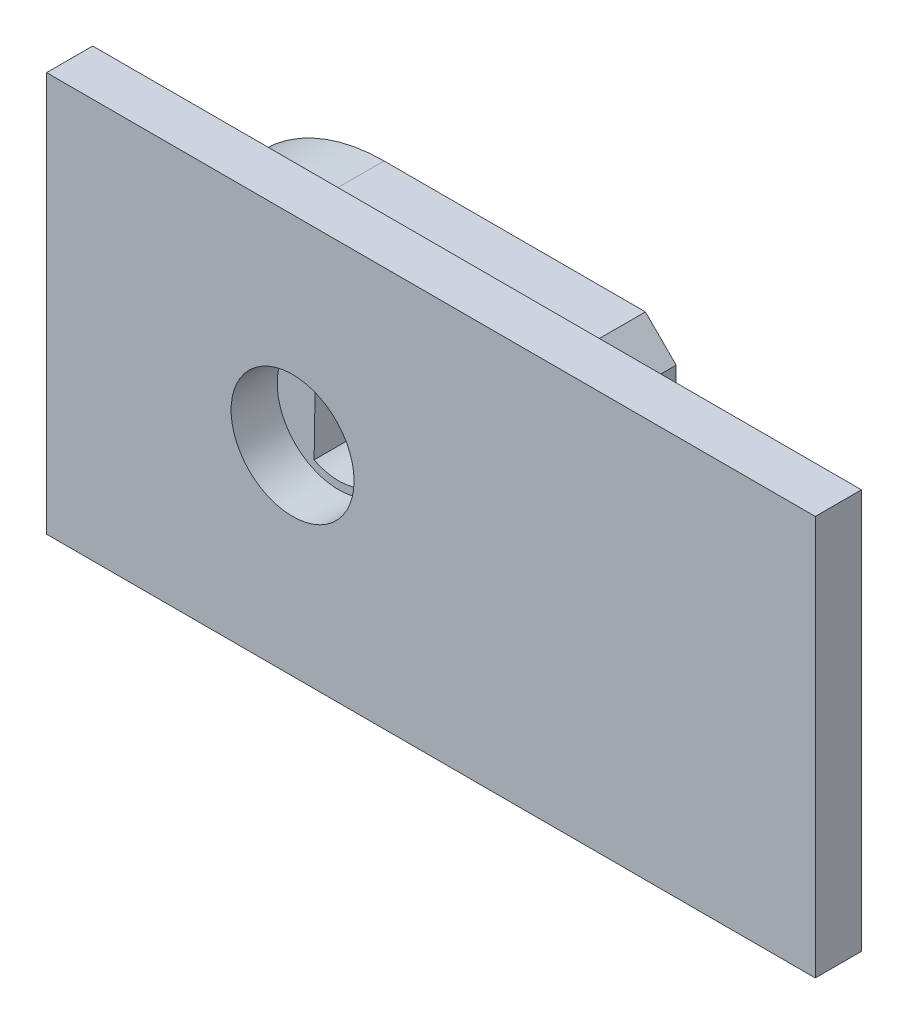
from build123d import *

# Parameters (mm, degrees)
SKETCH_1_W          = 25
SKETCH_1_H          = 13
EXTRUDE_1_DEPTH     = 1.5
SKETCH_2_R          = 2
CUT_EXTRUDE_1_DEPTH = 2.8
SKETCH_3_W          = 15
SKETCH_3_H          = 11
EXTRUDE_2_DEPTH     = 2.5
FILLET_1_R          = 5.5
CHAMFER_1_SIZE      = 1


with BuildPart() as part:
    # 草图1 → 凸台-拉伸1 (new body)
    with BuildSketch(Plane.XY):
        with Locations((12.5, 6.5)):
            Rectangle(SKETCH_1_W, SKETCH_1_H)
    extrude(amount=EXTRUDE_1_DEPTH)

    # 草图2 → 切除-拉伸1 (cut)
    with BuildSketch(Plane.XY.offset(1.5)):
        with Locations((8, 6.5)):
            Circle(SKETCH_2_R)
    extrude(amount=-CUT_EXTRUDE_1_DEPTH, mode=Mode.SUBTRACT)

    # 草图3 → 凸台-拉伸2 (add)
    with BuildSketch(Plane(origin=(0, 0, 0), x_dir=(-1, 0, 0), z_dir=(0, 0, -1))):
        with Locations((-8.976194502, 6.5)):
            Rectangle(SKETCH_3_W, SKETCH_3_H)
        with BuildLine():
            Line((-7.25, 8.08113883), (-7.200635773, 4.943235139))
            ThreePointArc((-7.200635773, 4.943235139), (-9.749783493, 6.472473116), (-7.25, 8.08113883))
        make_face(mode=Mode.SUBTRACT)
    extrude(amount=EXTRUDE_2_DEPTH)

    # 圆角1
    fillet_1_edges = [part.edges().sort_by_distance(p)[0] for p in [
        (1.476194502, 1, -1.25),
        (1.476194502, 12, -1.25),
    ]]
    fillet(fillet_1_edges, radius=FILLET_1_R - 0.0001)  # a hair under: the kernel refuses the full size

    # 倒角1
    chamfer_1_edges = [part.edges().sort_by_distance(p)[0] for p in [
        (16.476194502, 12, -1.25),
        (16.476194502, 1, -1.25),
    ]]
    chamfer(chamfer_1_edges, length=CHAMFER_1_SIZE)


solid = part.part
